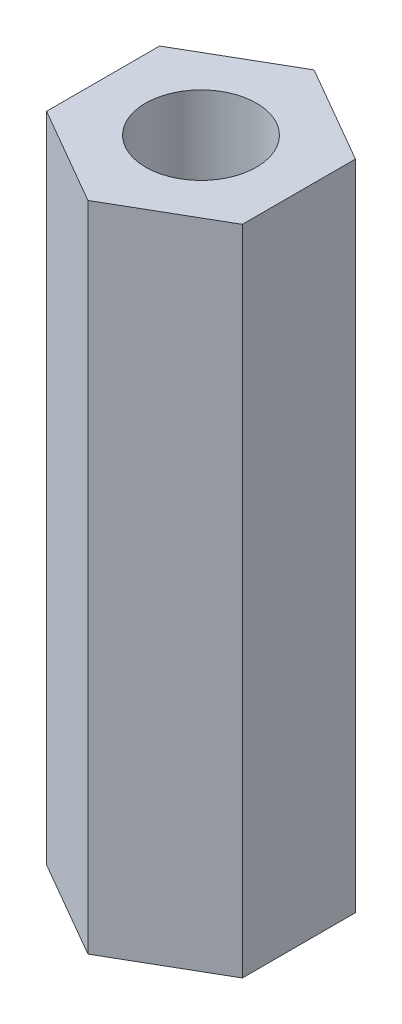
from build123d import *

# Parameters (mm, degrees)
SKETCH1_R           = 0.85
BOSS_EXTRUDE1_DEPTH = 10


with BuildPart() as part:
    # Sketch1 → Boss-Extrude1 (new body)
    with BuildSketch(Plane(origin=(0, 0, 0), x_dir=(1, 0, 0), z_dir=(0, 1, 0))):
        Polygon((0, -1.732050808), (1.5, -0.866025404), (1.5, 0.866025404), (0, 1.732050808), (-1.5, 0.866025404), (-1.5, -0.866025404), align=None)
        Circle(SKETCH1_R, mode=Mode.SUBTRACT)
    extrude(amount=BOSS_EXTRUDE1_DEPTH)


solid = part.part
